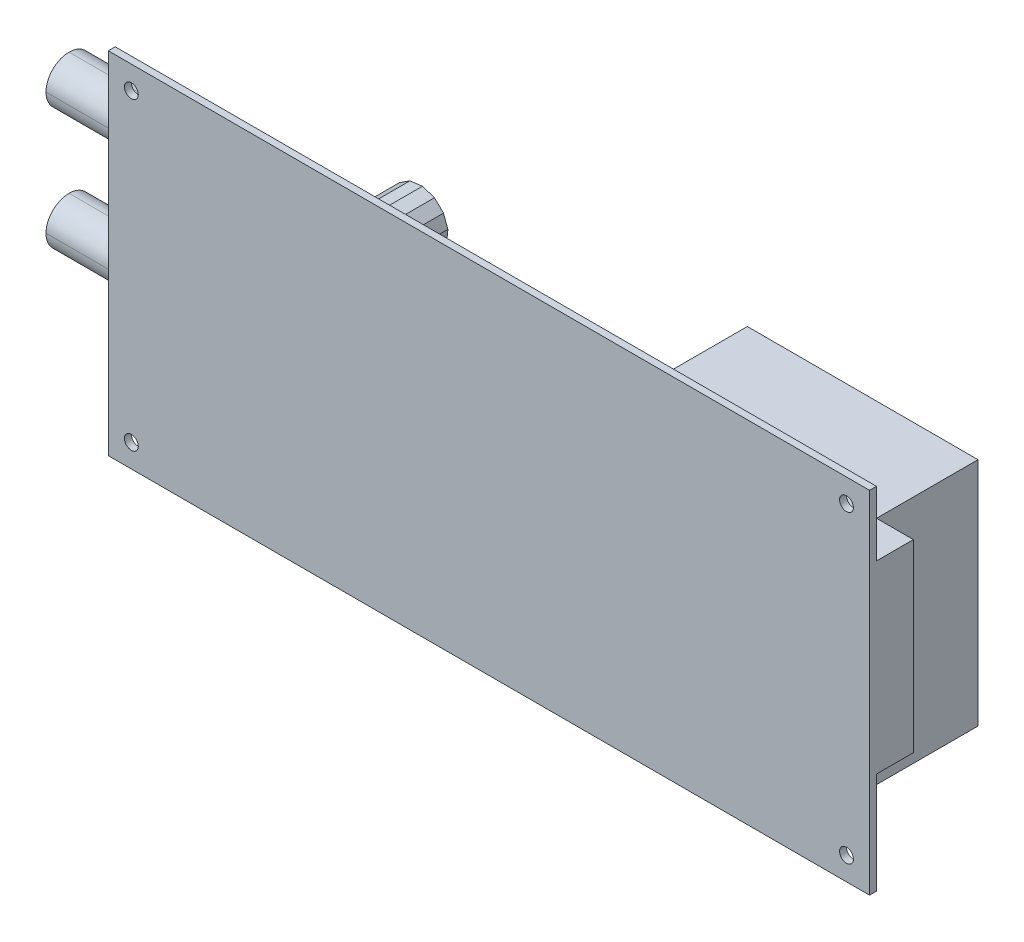
from build123d import *

# Parameters (mm, degrees)
SKETCH1_W           = 165
SKETCH1_H           = 76
BOSS_EXTRUDE1_DEPTH = 1.5
CUT_EXTRUDE1_REACH  = 140.731
SKETCH2_R           = 1.5
SKETCH3_W           = 12
SKETCH3_H           = 40
BOSS_EXTRUDE2_DEPTH = 8
SKETCH4_W           = 50
SKETCH4_H           = 50
BOSS_EXTRUDE3_DEPTH = 32
SKETCH5_W           = 30
SKETCH5_H           = 10
BOSS_EXTRUDE4_DEPTH = 10
BOSS_EXTRUDE5_DEPTH = 25
FILLET2_R           = 5
SKETCH8_R           = 4.5
SKETCH8_R_2         = 0.75
CUT_EXTRUDE2_DEPTH  = 6
CUT_EXTRUDE3_DEPTH  = 3


with BuildPart() as part:
    # Sketch1 → Boss-Extrude1 (new body)
    with BuildSketch(Plane.XY):
        with Locations((47.261306533, -11.052763819)):
            Rectangle(SKETCH1_W, SKETCH1_H)
    extrude(amount=BOSS_EXTRUDE1_DEPTH)

    # Sketch2 → Cut-Extrude1 (cut, up to next)
    with BuildSketch(Plane.XY.offset(1.5), mode=Mode.PRIVATE) as cut_extrude1_sk1:
        with Locations((124.761306533, 21.947236181)):
            Circle(SKETCH2_R)
    cut_extrude1_tool1 = extrude(cut_extrude1_sk1.sketch, amount=-CUT_EXTRUDE1_REACH, mode=Mode.PRIVATE) & part.part
    # Sketch2 → Cut-Extrude1 (cut, up to next)
    with BuildSketch(Plane.XY.offset(1.5), mode=Mode.PRIVATE) as cut_extrude1_sk2:
        with Locations((124.761306533, -44.052763819)):
            Circle(SKETCH2_R)
    cut_extrude1_tool2 = extrude(cut_extrude1_sk2.sketch, amount=-CUT_EXTRUDE1_REACH, mode=Mode.PRIVATE) & part.part
    # Sketch2 → Cut-Extrude1 (cut, up to next)
    with BuildSketch(Plane.XY.offset(1.5), mode=Mode.PRIVATE) as cut_extrude1_sk3:
        with Locations((-30.238693467, -44.052763819)):
            Circle(SKETCH2_R)
    cut_extrude1_tool3 = extrude(cut_extrude1_sk3.sketch, amount=-CUT_EXTRUDE1_REACH, mode=Mode.PRIVATE) & part.part
    # Sketch2 → Cut-Extrude1 (cut, up to next)
    with BuildSketch(Plane.XY.offset(1.5), mode=Mode.PRIVATE) as cut_extrude1_sk4:
        with Locations((-30.238693467, 21.947236181)):
            Circle(SKETCH2_R)
    cut_extrude1_tool4 = extrude(cut_extrude1_sk4.sketch, amount=-CUT_EXTRUDE1_REACH, mode=Mode.PRIVATE) & part.part
    add(cut_extrude1_tool1.solids().sort_by_distance((124.761307, 21.947236, 1.5))[0], mode=Mode.SUBTRACT)
    add(cut_extrude1_tool2.solids().sort_by_distance((124.761307, -44.052764, 1.5))[0], mode=Mode.SUBTRACT)
    add(cut_extrude1_tool3.solids().sort_by_distance((-30.238693, -44.052764, 1.5))[0], mode=Mode.SUBTRACT)
    add(cut_extrude1_tool4.solids().sort_by_distance((-30.238693, 21.947236, 1.5))[0], mode=Mode.SUBTRACT)

    # Sketch3 → Boss-Extrude2 (add)
    with BuildSketch(Plane(origin=(0, 0, 0), x_dir=(-1, 0, 0), z_dir=(0, 0, -1))):
        with Locations((-123.761306533, -7.052763819)):
            Rectangle(SKETCH3_W, SKETCH3_H)
    extrude(amount=BOSS_EXTRUDE2_DEPTH)

    # Sketch4 → Boss-Extrude3 (add)
    with BuildSketch(Plane(origin=(0, 0, 0), x_dir=(-1, 0, 0), z_dir=(0, 0, -1))):
        with Locations((-94.761306533, -14.052763819)):
            Rectangle(SKETCH4_W, SKETCH4_H)
    extrude(amount=BOSS_EXTRUDE3_DEPTH)

    # Sketch5 → Boss-Extrude4 (add)
    with BuildSketch(Plane(origin=(0, 0, 0), x_dir=(-1, 0, 0), z_dir=(0, 0, -1))):
        with Locations((35.238693467, 10.947236181)):
            Rectangle(SKETCH5_W, SKETCH5_H)
        with Locations((35.238693467, -15.552763819)):
            Rectangle(SKETCH5_W, SKETCH5_H)
    extrude(amount=BOSS_EXTRUDE4_DEPTH)

    # Sketch6 → Boss-Extrude5 (add)
    with BuildSketch(Plane(origin=(0, 0, 0), x_dir=(-1, 0, 0), z_dir=(0, 0, -1))):
        Polygon((0.079164122, 4.887423166), (-1.341039882, 7.229369498), (-3.636731908, 8.72318681), (-6.353221994, 9.073006263), (-8.952475964, 8.209541823), (-10.919679691, 6.303813212), (-11.86520435, 3.733273355), (-11.601777188, 1.007049196), (-10.181573183, -1.334897137), (-7.885881157, -2.828714449), (-5.169391071, -3.178533901), (-2.570137101, -2.315069461), (-0.602933374, -0.409340851), (0.342591285, 2.161199006), align=None)
    extrude(amount=BOSS_EXTRUDE5_DEPTH)

    # Fillet2
    fillet2_edges = [part.edges().sort_by_distance(p)[0] for p in [
        (-42.738693467, 5.947236181, 0),
        (-42.738693467, 15.947236181, 0),
        (-35.238693467, 15.947236181, -10),
        (-35.238693467, 5.947236181, -10),
        (-42.738693467, -20.552763819, 0),
        (-42.738693467, -10.552763819, 0),
        (-35.238693467, -10.552763819, -10),
        (-35.238693467, -20.552763819, -10),
    ]]
    fillet(fillet2_edges, radius=FILLET2_R - 0.0001)  # a hair under: the kernel refuses the full size

    # Sketch8 → Cut-Extrude2 (cut)
    # profile 1 of 2: a face of its own
    with BuildSketch(Plane.ZY.offset(50.238693467)):
        with Locations((-5, -15.552763819)):
            Circle(SKETCH8_R)
        with Locations((-5, -15.552763819)):
            Circle(SKETCH8_R_2, mode=Mode.SUBTRACT)
    # profile 2 of 2: a face of its own
    with BuildSketch(Plane.ZY.offset(50.238693467)):
        with Locations((-5, 10.947236181)):
            Circle(SKETCH8_R)
        with Locations((-5, 10.947236181)):
            Circle(SKETCH8_R_2, mode=Mode.SUBTRACT)
    extrude(amount=-CUT_EXTRUDE2_DEPTH, mode=Mode.SUBTRACT)

    # Sketch10 → Cut-Extrude3 (cut)
    with BuildSketch(Plane(origin=(0, 0, -25), x_dir=(-1, 0, 0), z_dir=(0, 0, -1))):
        Polygon((-5.761306533, 2.947236181), (-1.341039882, 7.229369498), (0.079164122, 4.887423166), align=None)
    extrude(amount=-CUT_EXTRUDE3_DEPTH, mode=Mode.SUBTRACT)


solid = part.part
